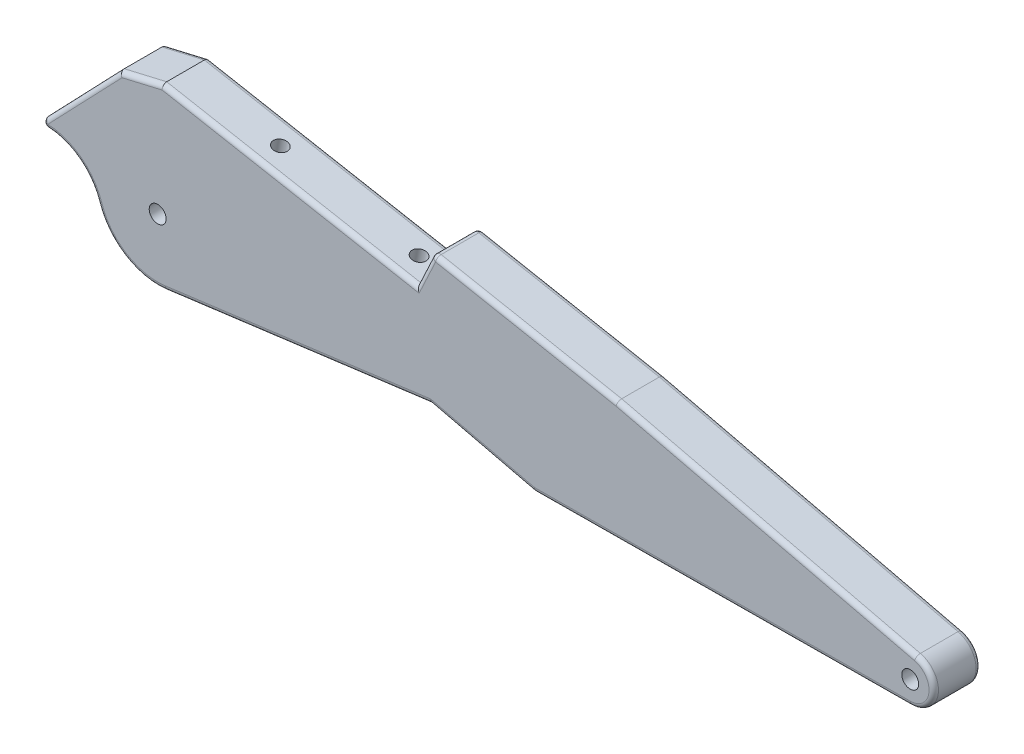
from build123d import *

# Parameters (mm, degrees)
SKETCH1_R           = 2.286
BOSS_EXTRUDE1_DEPTH = 12.7
FILLET1_R           = 1.27
SKETCH2_R           = 5.23875
CUT_EXTRUDE1_DEPTH  = 3.96875
SKETCH3_R           = 1.905
CUT_EXTRUDE2_DEPTH  = 12.7
SKETCH4_R           = 1.905
CUT_EXTRUDE3_DEPTH  = 12.7


with BuildPart() as part:
    # Sketch1 → Boss-Extrude1 (new body)
    with BuildSketch(Plane.XY):
        with BuildLine():
            Line((0.048604687, -6.34981398), (-101.551395313, -7.127511762))
            Line((-101.551395313, -7.127511762), (-129.54, -0.455968887))
            Line((-129.54, -0.455968887), (-200.976985186, -9.797318323))
            ThreePointArc((-200.976985186, -9.797318323), (-212.345316252, -7.299261014), (-219.498657731, 1.882729359))
            ThreePointArc((-219.498657731, 1.882729359), (-225.881522093, 9.955739927), (-235.978343153, 11.947889917))
            Line((-235.978343153, 11.947889917), (-213.484943721, 35.424049649))
            Line((-213.484943721, 35.424049649), (-202.035751798, 38.1))
            Line((-202.035751798, 38.1), (-133.35, 25.4))
            Line((-133.35, 25.4), (-128.905, 34.925))
            Line((-128.905, 34.925), (-79.17262462, 25.4))
            Line((-79.17262462, 25.4), (1.47237538, 6.17694186))
            ThreePointArc((1.47237538, 6.17694186), (6.309377787, -0.717113616), (0.048604687, -6.34981398))
        make_face()
        Circle(SKETCH1_R, mode=Mode.SUBTRACT)
        with Locations((-203.2, 7.20295315)):
            Circle(SKETCH1_R, mode=Mode.SUBTRACT)
    extrude(amount=BOSS_EXTRUDE1_DEPTH)

    # Fillet1
    fillet1_edges = [part.edges().sort_by_distance(p)[0] for p in [
        (-165.258492593, -5.126643605, 12.7),
        (-212.345316252, -7.299261014, 12.7),
        (-38.85012462, 15.78847093, 12.7),
        (-225.881522093, 9.955739927, 0),
        (-212.345316252, -7.299261014, 0),
        (-50.751395313, -6.738662871, 0),
        (-225.881522093, 9.955739927, 12.7),
        (-224.731643437, 23.685969783, 12.7),
        (-207.760347759, 36.762024825, 12.7),
        (-167.692875899, 31.75, 12.7),
        (-131.1275, 30.1625, 0),
        (-131.1275, 30.1625, 12.7),
        (-104.03881231, 30.1625, 12.7),
        (-115.545697656, -3.791740325, 12.7),
        (-50.751395313, -6.738662871, 12.7),
        (-207.760347759, 36.762024825, 0),
        (-224.731643437, 23.685969783, 0),
        (-167.692875899, 31.75, 0),
        (-128.905, 34.925, 6.35),
        (-165.258492593, -5.126643605, 0),
        (-115.545697656, -3.791740325, 0),
        (-38.85012462, 15.78847093, 0),
        (-104.03881231, 30.1625, 0),
        (6.309377787, -0.717113616, 12.7),
        (6.309377787, -0.717113616, 0),
        (-235.978343153, 11.947889917, 6.35),
    ]]
    fillet(fillet1_edges, radius=FILLET1_R)

    # Sketch2 → Cut-Extrude1 (cut)
    with BuildSketch(Plane(origin=(0, 0, 0), x_dir=(-1, 0, 0), z_dir=(0, 0, -1))):
        Circle(SKETCH2_R)
    extrude(amount=-CUT_EXTRUDE1_DEPTH, mode=Mode.SUBTRACT)

    # Sketch3 → Cut-Extrude2 (cut)
    with BuildSketch(Plane(origin=(0.132942268, 0.718995244, 0), x_dir=(0.9833321660356336, -0.18181818181818188, 0), z_dir=(0.18181818181818188, 0.9833321660356336, 0))):
        with Locations((-179.556061292, -6.35)):
            Circle(SKETCH3_R)
        with Locations((-141.456061292, -6.35)):
            Circle(SKETCH3_R)
    extrude(amount=-CUT_EXTRUDE2_DEPTH, mode=Mode.SUBTRACT)

    # Sketch4 → Cut-Extrude3 (cut)
    with BuildSketch(Plane(origin=(-129.000217133, 123.600002885, 0), x_dir=(0, 0, 1), z_dir=(-0.722058678628711, 0.6918318181588355, 0))):
        with Locations((6.35, -146.342507251)):
            Circle(SKETCH4_R)
    extrude(amount=-CUT_EXTRUDE3_DEPTH, mode=Mode.SUBTRACT)


solid = part.part
